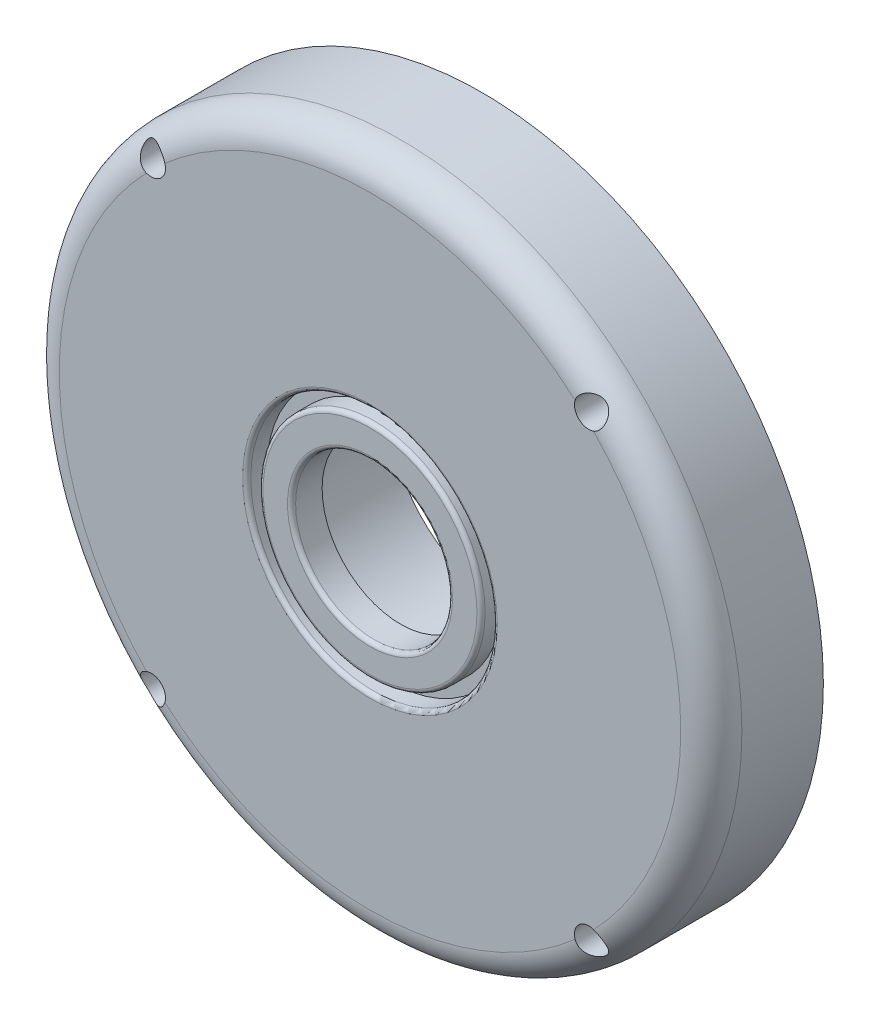
from build123d import *

# Parameters (mm, degrees)
IZIM1_R                     = 148
Y_KSEKLIK_EKSTR_ZYON1_DEPTH = 60
Y_KSEKLIK_EKSTR_ZYON2_START = 10
IZIM2_R                     = 167.5
Y_KSEKLIK_EKSTR_ZYON2_DEPTH = 50
IZIM3_R                     = 55
KES_EKSTR_ZYON1_DEPTH       = 741
Y_KSEKLIK_EKSTR_ZYON3_START = -50
IZIM4_R                     = 55
IZIM4_R_2                   = 38.5
Y_KSEKLIK_EKSTR_ZYON3_DEPTH = 10
IZIM5_R                     = 167.5
IZIM5_R_2                   = 38.5
Y_KSEKLIK_EKSTR_ZYON4_DEPTH = 5
IZIM6_R                     = 60.5
IZIM6_R_2                   = 54.5
KES_EKSTR_ZYON2_DEPTH       = 10
IZIM7_R                     = 4
KES_EKSTR_ZYON3_DEPTH       = 55
IZIM8_R                     = 7
KES_EKSTR_ZYON4_DEPTH       = 17
RADYUS1_R                   = 15
RADYUS2_R                   = 2


with BuildPart() as part:
    # Çizim1 → Yükseklik-Ekstrüzyon1 (new body)
    with BuildSketch(Plane.XY):
        Circle(IZIM1_R)
    extrude(amount=Y_KSEKLIK_EKSTR_ZYON1_DEPTH)

    # Çizim2 → Yükseklik-Ekstrüzyon2 (add)
    with BuildSketch(Plane.XY.offset(Y_KSEKLIK_EKSTR_ZYON2_START)):
        Circle(IZIM2_R)
    extrude(amount=Y_KSEKLIK_EKSTR_ZYON2_DEPTH)

    # Çizim3 → Kes-Ekstrüzyon1 (cut)
    with BuildSketch(Plane(origin=(0, 0, 0), x_dir=(-1, 0, 0), z_dir=(0, 0, -1))):
        Circle(IZIM3_R)
    extrude(amount=-KES_EKSTR_ZYON1_DEPTH, mode=Mode.SUBTRACT)

    # Çizim4 → Yükseklik-Ekstrüzyon3 (add)
    with BuildSketch(Plane(origin=(0, 0, 0), x_dir=(-1, 0, 0), z_dir=(0, 0, -1)).offset(Y_KSEKLIK_EKSTR_ZYON3_START)):
        Circle(IZIM4_R)
        Circle(IZIM4_R_2, mode=Mode.SUBTRACT)
    extrude(amount=-Y_KSEKLIK_EKSTR_ZYON3_DEPTH)

    # Çizim5 → Yükseklik-Ekstrüzyon4 (add)
    with BuildSketch(Plane.XY.offset(60)):
        Circle(IZIM5_R)
        with Locations(Location((0, 0, 0), (0, 0, 180))):
            Circle(IZIM5_R_2, mode=Mode.SUBTRACT)
    extrude(amount=Y_KSEKLIK_EKSTR_ZYON4_DEPTH)

    # Çizim6 → Kes-Ekstrüzyon2 (cut)
    with BuildSketch(Plane.XY.offset(65)):
        Circle(IZIM6_R)
        Circle(IZIM6_R_2, mode=Mode.SUBTRACT)
    extrude(amount=-KES_EKSTR_ZYON2_DEPTH, mode=Mode.SUBTRACT)

    # Çizim7 → Kes-Ekstrüzyon3 (cut)
    with BuildSketch(Plane.XY.offset(65)):
        with Locations((-107.349895203, 112.5)):
            Circle(IZIM7_R)
        with Locations((107.349895203, 112.5)):
            Circle(IZIM7_R)
        with Locations((107.349895203, -112.5)):
            Circle(IZIM7_R)
        with Locations((-107.349895203, -112.5)):
            Circle(IZIM7_R)
    extrude(amount=-KES_EKSTR_ZYON3_DEPTH, mode=Mode.SUBTRACT)

    # Çizim8 → Kes-Ekstrüzyon4 (cut)
    with BuildSketch(Plane.XY.offset(65)):
        with Locations((-107.349895203, 112.5)):
            Circle(IZIM8_R)
        with Locations((107.349895203, 112.5)):
            Circle(IZIM8_R)
        with Locations((107.349895203, -112.5)):
            Circle(IZIM8_R)
        with Locations((-107.349895203, -112.5)):
            Circle(IZIM8_R)
    extrude(amount=-KES_EKSTR_ZYON4_DEPTH, mode=Mode.SUBTRACT)

    # Radyus1
    # the kernel refuses this fillet: 15 mm, written as the material it takes off along each edge
    with BuildSketch(Plane(origin=(0, 0, 65), x_dir=(1, 0, 0), z_dir=(0, -1, 0))) as radyus1_piece_1:
        with BuildLine():
            CenterArc((167.5 - RADYUS1_R, -RADYUS1_R), RADYUS1_R, 0, 90)
            Line((167.5 - RADYUS1_R, 0), (167.5, 0))
            Line((167.5, 0), (167.5, -RADYUS1_R))
        make_face()
    revolve(axis=Axis((0, 0, 65), (0, 0, 1)), mode=Mode.SUBTRACT)

    # Radyus2
    radyus2_edges = [part.edges().sort_by_distance(p)[0] for p in [
        (38.5, 0, 65),
        (-60.5, 0, 65),
        (-54.5, 0, 65),
    ]]
    fillet(radyus2_edges, radius=RADYUS2_R)


solid = part.part
